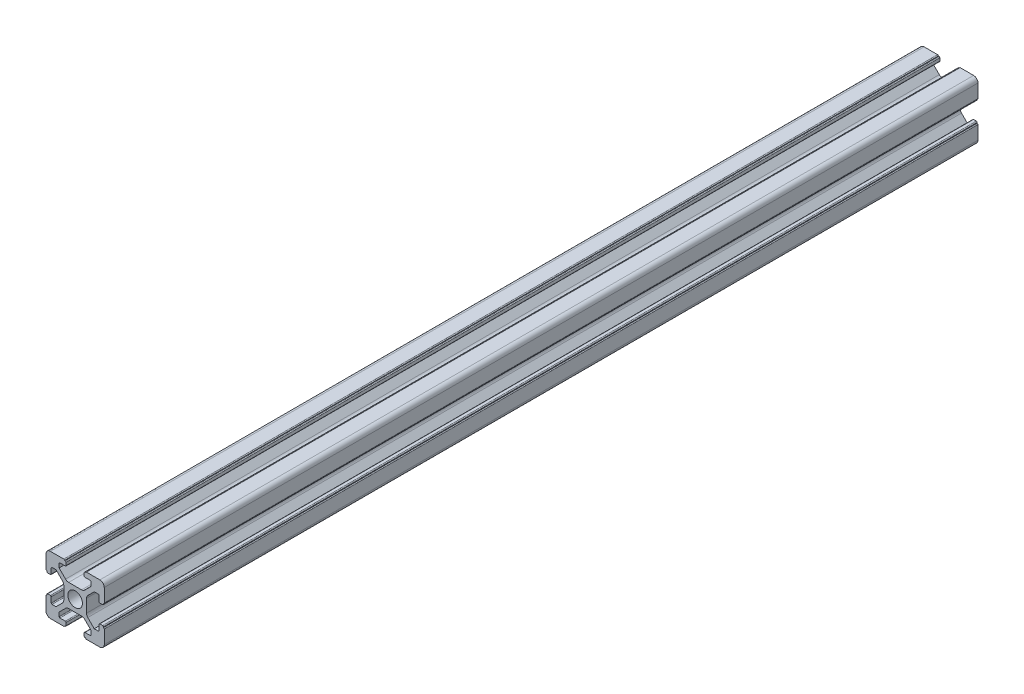
from build123d import *

# Parameters (mm, degrees)
BOSS_EXTRUDE1_DEPTH = 300
F_3DSKETCH2_R       = 2.5
CUT_EXTRUDE1_DEPTH  = 301.333261686


with BuildPart() as part:
    # Sketch1 → Boss-Extrude1 (new body)
    with BuildSketch(Plane.XY):
        with BuildLine():
            ThreePointArc((-4.339541497, 3.27832502), (-4.01438237, 2.791689997), (-3.900201668, 2.217664848))
            Line((-3.900201668, 2.217664848), (-3.900201668, -2.220777458))
            ThreePointArc((-3.900201668, -2.220777458), (-4.013982246, -2.793835668), (-4.338062619, -3.279956687))
            ThreePointArc((-4.338062619, -3.279956687), (-4.338801799, -3.280697416), (-4.339541497, -3.28143763))
            Line((-4.339541497, -3.28143763), (-6.559305445, -5.501201578))
            Line((-6.559305445, -5.501201578), (-7.918645273, -5.501201578))
            ThreePointArc((-7.918645273, -5.501201578), (-8.116635172, -5.419191476), (-8.198645273, -5.221201578))
            Line((-8.198645273, -5.221201578), (-8.198645273, -3.381201578))
            ThreePointArc((-8.198645273, -3.381201578), (-8.280655374, -3.183211679), (-8.478645273, -3.101201578))
            Line((-8.478645273, -3.101201578), (-9.418645273, -3.101201578))
            ThreePointArc((-9.418645273, -3.101201578), (-9.616635172, -3.183211679), (-9.698645273, -3.381201578))
            Line((-9.698645273, -3.381201578), (-9.698645273, -3.601201578))
            Line((-9.698645273, -3.601201578), (-9.718645273, -3.601201578))
            ThreePointArc((-9.718645273, -3.601201578), (-9.916635172, -3.683211679), (-9.998645273, -3.881201578))
            Line((-9.998645273, -3.881201578), (-9.998645273, -8.501201578))
            ThreePointArc((-9.998645273, -8.501201578), (-9.559305445, -9.561861749), (-8.498645273, -10.001201578))
            Line((-8.498645273, -10.001201578), (-3.878645273, -10.001201578))
            ThreePointArc((-3.878645273, -10.001201578), (-3.680655374, -9.919191476), (-3.598645273, -9.721201578))
            Line((-3.598645273, -9.721201578), (-3.598645273, -9.701201578))
            Line((-3.598645273, -9.701201578), (-3.378645273, -9.701201578))
            ThreePointArc((-3.378645273, -9.701201578), (-3.180655374, -9.619191476), (-3.098645273, -9.421201578))
            Line((-3.098645273, -9.421201578), (-3.098645273, -8.481201578))
            ThreePointArc((-3.098645273, -8.481201578), (-3.180655374, -8.283211679), (-3.378645273, -8.201201578))
            Line((-3.378645273, -8.201201578), (-5.218645273, -8.201201578))
            ThreePointArc((-5.218645273, -8.201201578), (-5.416635172, -8.119191476), (-5.498645273, -7.921201578))
            Line((-5.498645273, -7.921201578), (-5.498645273, -6.561861749))
            Line((-5.498645273, -6.561861749), (-3.277324929, -4.340541406))
            ThreePointArc((-3.277324929, -4.340541406), (-2.790689906, -4.015382279), (-2.216664757, -3.901201578))
            Line((-2.216664757, -3.901201578), (2.234977304, -3.899793498))
            ThreePointArc((2.234977304, -3.899793498), (2.801097117, -4.016727825), (3.280957809, -4.339061494))
            Line((3.280957809, -4.339061494), (5.502201668, -6.560305354))
            Line((5.502201668, -6.560305354), (5.502201668, -7.919645182))
            ThreePointArc((5.502201668, -7.919645182), (5.420191567, -8.117635081), (5.222201668, -8.199645182))
            Line((5.222201668, -8.199645182), (3.382201668, -8.199645182))
            ThreePointArc((3.382201668, -8.199645182), (3.18421177, -8.281655283), (3.102201668, -8.479645182))
            Line((3.102201668, -8.479645182), (3.102201668, -9.419645182))
            ThreePointArc((3.102201668, -9.419645182), (3.18421177, -9.617635081), (3.382201668, -9.699645182))
            Line((3.382201668, -9.699645182), (3.602201668, -9.699645182))
            Line((3.602201668, -9.699645182), (3.602201668, -9.719645182))
            ThreePointArc((3.602201668, -9.719645182), (3.68421177, -9.917635081), (3.882201668, -9.999645182))
            Line((3.882201668, -9.999645182), (8.502201668, -9.999645182))
            ThreePointArc((8.502201668, -9.999645182), (9.56286184, -9.560305354), (10.002201668, -8.499645182))
            Line((10.002201668, -8.499645182), (10.002201668, -3.879645182))
            ThreePointArc((10.002201668, -3.879645182), (9.920191567, -3.681655283), (9.722201668, -3.599645182))
            Line((9.722201668, -3.599645182), (9.702201668, -3.599645182))
            Line((9.702201668, -3.599645182), (9.702201668, -3.379645182))
            ThreePointArc((9.702201668, -3.379645182), (9.620191567, -3.181655283), (9.422201668, -3.099645182))
            Line((9.422201668, -3.099645182), (8.482201668, -3.099645182))
            ThreePointArc((8.482201668, -3.099645182), (8.28421177, -3.181655283), (8.202201668, -3.379645182))
            Line((8.202201668, -3.379645182), (8.202201668, -5.219645182))
            ThreePointArc((8.202201668, -5.219645182), (8.120191567, -5.417635081), (7.922201668, -5.499645182))
            Line((7.922201668, -5.499645182), (6.56286184, -5.499645182))
            Line((6.56286184, -5.499645182), (4.341541497, -3.278324838))
            ThreePointArc((4.341541497, -3.278324838), (4.01638237, -2.791689815), (3.902201668, -2.217664667))
            Line((3.902201668, -2.217664667), (3.900793589, 2.233977395))
            ThreePointArc((3.900793589, 2.233977395), (4.017727916, 2.800097207), (4.340061585, 3.2799579))
            Line((4.340061585, 3.2799579), (6.561305445, 5.501201759))
            Line((6.561305445, 5.501201759), (7.920645273, 5.501201759))
            ThreePointArc((7.920645273, 5.501201759), (8.118635172, 5.419191658), (8.200645273, 5.221201759))
            Line((8.200645273, 5.221201759), (8.200645273, 3.381201759))
            ThreePointArc((8.200645273, 3.381201759), (8.282655374, 3.183211861), (8.480645273, 3.101201759))
            Line((8.480645273, 3.101201759), (9.420645273, 3.101201759))
            ThreePointArc((9.420645273, 3.101201759), (9.618635172, 3.183211861), (9.700645273, 3.381201759))
            Line((9.700645273, 3.381201759), (9.700645273, 3.601201759))
            Line((9.700645273, 3.601201759), (9.720645273, 3.601201759))
            ThreePointArc((9.720645273, 3.601201759), (9.918635172, 3.683211861), (10.000645273, 3.881201759))
            Line((10.000645273, 3.881201759), (10.000645273, 8.501201759))
            ThreePointArc((10.000645273, 8.501201759), (9.561305445, 9.561861931), (8.500645273, 10.001201759))
            Line((8.500645273, 10.001201759), (3.880645273, 10.001201759))
            ThreePointArc((3.880645273, 10.001201759), (3.682655374, 9.919191658), (3.600645273, 9.721201759))
            Line((3.600645273, 9.721201759), (3.600645273, 9.701201759))
            Line((3.600645273, 9.701201759), (3.380645273, 9.701201759))
            ThreePointArc((3.380645273, 9.701201759), (3.182655374, 9.619191658), (3.100645273, 9.421201759))
            Line((3.100645273, 9.421201759), (3.100645273, 8.481201759))
            ThreePointArc((3.100645273, 8.481201759), (3.182655374, 8.283211861), (3.380645273, 8.201201759))
            Line((3.380645273, 8.201201759), (5.220645273, 8.201201759))
            ThreePointArc((5.220645273, 8.201201759), (5.418635172, 8.119191658), (5.500645273, 7.921201759))
            Line((5.500645273, 7.921201759), (5.500645273, 6.561861931))
            Line((5.500645273, 6.561861931), (3.279324929, 4.340541588))
            ThreePointArc((3.279324929, 4.340541588), (2.792689906, 4.015382461), (2.218664757, 3.901201759))
            Line((2.218664757, 3.901201759), (-2.232977304, 3.89979368))
            ThreePointArc((-2.232977304, 3.89979368), (-2.799097117, 4.016728006), (-3.278957809, 4.339061676))
            Line((-3.278957809, 4.339061676), (-5.500201668, 6.560305535))
            Line((-5.500201668, 6.560305535), (-5.500201668, 7.919645364))
            ThreePointArc((-5.500201668, 7.919645364), (-5.418191567, 8.117635262), (-5.220201668, 8.199645364))
            Line((-5.220201668, 8.199645364), (-3.380201668, 8.199645364))
            ThreePointArc((-3.380201668, 8.199645364), (-3.18221177, 8.281655465), (-3.100201668, 8.479645364))
            Line((-3.100201668, 8.479645364), (-3.100201668, 9.419645364))
            ThreePointArc((-3.100201668, 9.419645364), (-3.18221177, 9.617635262), (-3.380201668, 9.699645364))
            Line((-3.380201668, 9.699645364), (-3.600201668, 9.699645364))
            Line((-3.600201668, 9.699645364), (-3.600201668, 9.719645364))
            ThreePointArc((-3.600201668, 9.719645364), (-3.68221177, 9.917635262), (-3.880201668, 9.999645364))
            Line((-3.880201668, 9.999645364), (-8.500201668, 9.999645364))
            ThreePointArc((-8.500201668, 9.999645364), (-9.56086184, 9.560305535), (-10.000201668, 8.499645364))
            Line((-10.000201668, 8.499645364), (-10.000201668, 3.879645364))
            ThreePointArc((-10.000201668, 3.879645364), (-9.918191567, 3.681655465), (-9.720201668, 3.599645364))
            Line((-9.720201668, 3.599645364), (-9.700201668, 3.599645364))
            Line((-9.700201668, 3.599645364), (-9.700201668, 3.379645364))
            ThreePointArc((-9.700201668, 3.379645364), (-9.618191567, 3.181655465), (-9.420201668, 3.099645364))
            Line((-9.420201668, 3.099645364), (-8.480201668, 3.099645364))
            ThreePointArc((-8.480201668, 3.099645364), (-8.28221177, 3.181655465), (-8.200201668, 3.379645364))
            Line((-8.200201668, 3.379645364), (-8.200201668, 5.219645364))
            ThreePointArc((-8.200201668, 5.219645364), (-8.118191567, 5.417635262), (-7.920201668, 5.499645364))
            Line((-7.920201668, 5.499645364), (-6.56086184, 5.499645364))
            Line((-6.56086184, 5.499645364), (-4.339541497, 3.27832502))
        make_face()
    extrude(amount=BOSS_EXTRUDE1_DEPTH)

    # 3DSketch2 → Cut-Extrude1 (cut, through all)
    with BuildSketch(Plane.XY):
        Circle(F_3DSKETCH2_R)
    extrude(amount=CUT_EXTRUDE1_DEPTH, mode=Mode.SUBTRACT)


solid = part.part
